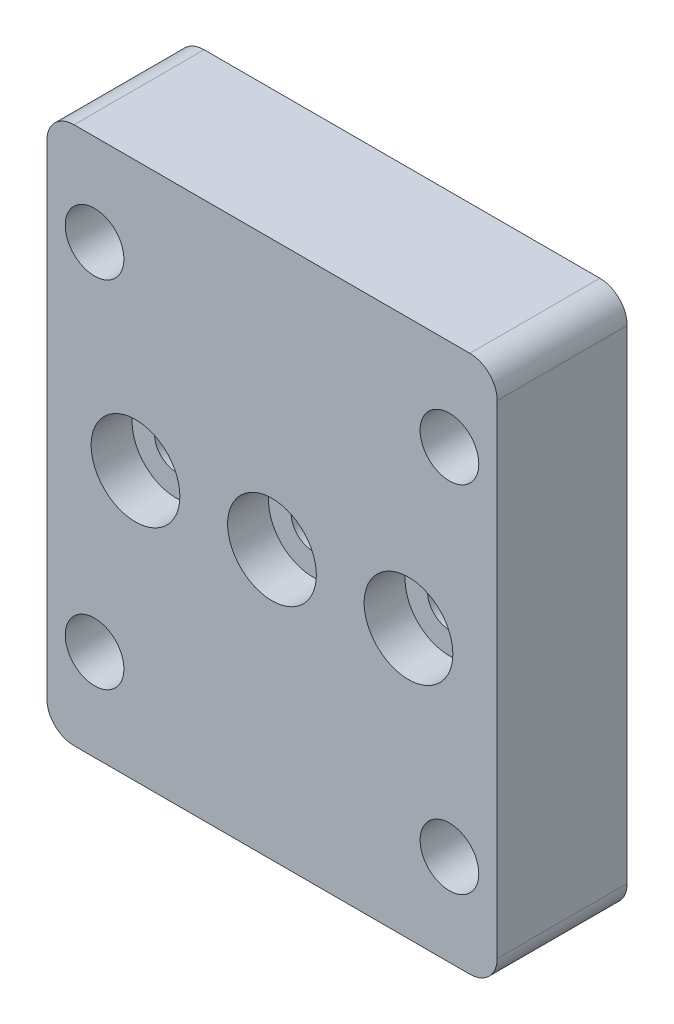
from build123d import *

# Parameters (mm, degrees)
SKETCH1_W                      = 33
SKETCH1_H                      = 39.4
BOSS_EXTRUDE1_DEPTH            = 9.525
CBORE_FOR_M3_SHCS1_D           = 3.2
CBORE_FOR_M3_SHCS1_CBORE_D     = 6.5
CBORE_FOR_M3_SHCS1_CBORE_DEPTH = 3
M4_CLEARANCE_HOLE1_D           = 4.3
FILLET1_R                      = 2


with BuildPart() as part:
    # Sketch1 → Boss-Extrude1 (new body)
    with BuildSketch(Plane.XY):
        Rectangle(SKETCH1_W, SKETCH1_H)
    extrude(amount=BOSS_EXTRUDE1_DEPTH)

    # CBORE for M3 SHCS1 (through all)
    with Locations(Plane.XY.offset(9.525)):
        with Locations((-10, 0), (0, 0), (10, 0)):
            CounterBoreHole(CBORE_FOR_M3_SHCS1_D / 2, CBORE_FOR_M3_SHCS1_CBORE_D / 2, CBORE_FOR_M3_SHCS1_CBORE_DEPTH)

    # M4 Clearance Hole1 (through all)
    with Locations(Plane.XY.offset(9.525)):
        with Locations((-13, 13), (-13, -13), (13, -13), (13, 13)):
            Hole(M4_CLEARANCE_HOLE1_D / 2)

    # Fillet1
    fillet1_edges = [part.edges().sort_by_distance(p)[0] for p in [
        (16.5, 19.7, 4.7625),
        (16.5, -19.7, 4.7625),
        (-16.5, -19.7, 4.7625),
        (-16.5, 19.7, 4.7625),
    ]]
    fillet(fillet1_edges, radius=FILLET1_R)


solid = part.part
